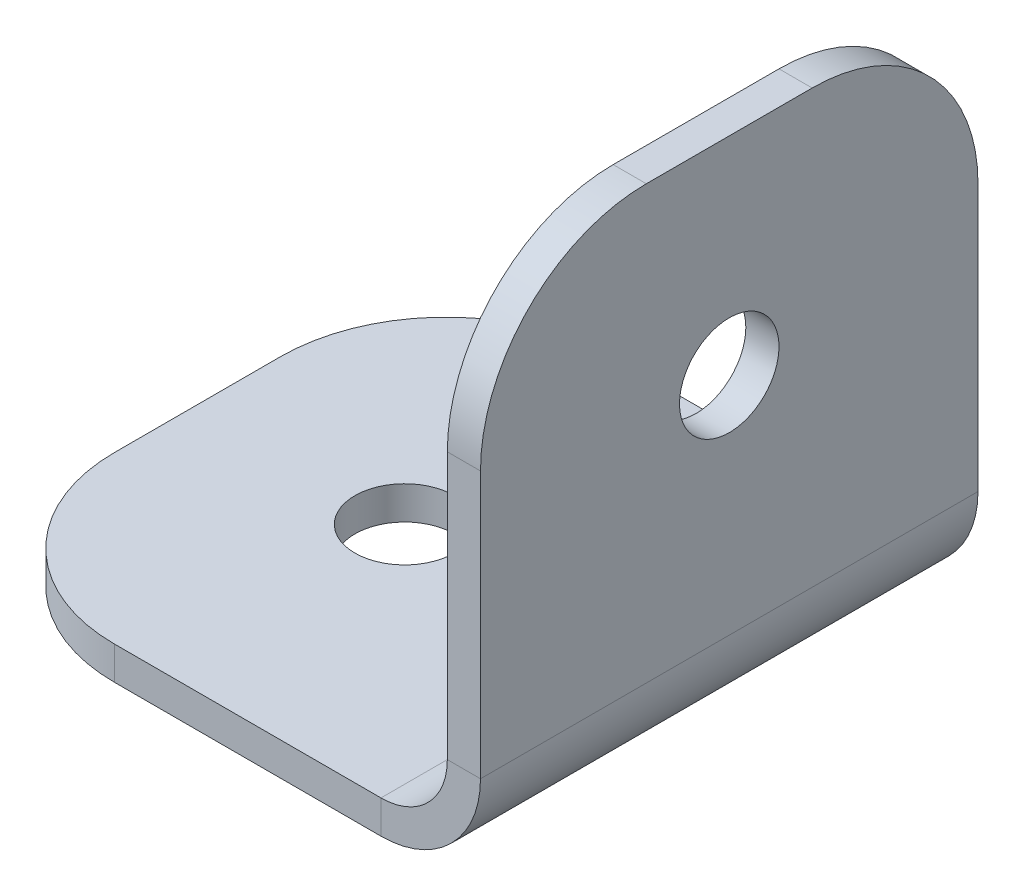
from build123d import *

# Parameters (mm, degrees)
SKETCH1_R                  = 3
EXTRUDE2_DEPTH             = 2
SKETCHED_START             = 1.456569183
SKETCHED_BEND1_OUTLINE_W   = 2
SKETCHED_BEND1_OUTLINE_H   = 30
SKETCHED_BEND1_DEPTH       = 28.543430817
SKETCHED_START_2           = 0.073009183
SKETCHED_BEND1_2_OUTLINE_R = 3
SKETCHED_BEND1_2_DEPTH     = 0.036590817
SKETCHED_START_3           = 0.608704599
SKETCHED_BEND1_3_OUTLINE_W = 2
SKETCHED_BEND1_3_OUTLINE_H = 30
SKETCHED_BEND1_3_DEPTH     = 0.847864584
SKETCHED_START_4           = -3.926990817
SKETCHED_BEND1_4_OUTLINE_R = 3
SKETCHED_BEND1_4_DEPTH     = 6
SKETCHED_START_5           = -15
SKETCHED_BEND1_5_DEPTH     = 30


with BuildPart() as part:
    # Sketch1 → Extrude2 (new body)
    with BuildSketch(Plane(origin=(0, 0, 0), x_dir=(1, 0, 0), z_dir=(0, 1, 0))):
        with BuildLine():
            Line((-20, -15), (20, -15))
            ThreePointArc((20, -15), (27.071067812, -12.071067812), (30, -5))
            Line((30, -5), (30, 5))
            ThreePointArc((30, 5), (27.071067812, 12.071067812), (20, 15))
            Line((20, 15), (-20, 15))
            ThreePointArc((-20, 15), (-27.071067812, 12.071067812), (-30, 5))
            Line((-30, 5), (-30, -5))
            ThreePointArc((-30, -5), (-27.071067812, -12.071067812), (-20, -15))
        make_face()
        with Locations(Location((-17.5, 0, 0), (0, 0, 270))):
            Circle(SKETCH1_R, mode=Mode.SUBTRACT)
        with Locations(Location((17.5, 0, 0), (0, 0, 90))):
            Circle(SKETCH1_R, mode=Mode.SUBTRACT)
    extrude(amount=EXTRUDE2_DEPTH)

    # Sketched Bend1: read off the stored shape, not the designer's step
    # Sketched Bend1 outline → Sketched Bend1 (cut)
    with BuildSketch(Plane.YZ.offset(SKETCHED_START)):
        with Locations((1, 0)):
            Rectangle(SKETCHED_BEND1_OUTLINE_W, SKETCHED_BEND1_OUTLINE_H)
    extrude(amount=SKETCHED_BEND1_DEPTH, mode=Mode.SUBTRACT)

    # Sketched Bend1 2 outline → Sketched Bend1 2 (add)
    with BuildSketch(Plane.YZ.offset(SKETCHED_START_2)):
        with BuildLine():
            Line((22.073009183, 15), (2, 15))
            Line((2, 15), (2, -15))
            Line((2, -15), (22.073009183, -15))
            ThreePointArc((22.073009183, -15), (29.144076995, -12.071067812), (32.073009183, -5))
            Line((32.073009183, -5), (32.073009183, 5))
            ThreePointArc((32.073009183, 5), (29.144076995, 12.071067812), (22.073009183, 15))
        make_face()
        with Locations((19.573009183, 0)):
            Circle(SKETCHED_BEND1_2_OUTLINE_R, mode=Mode.SUBTRACT)
    extrude(amount=SKETCHED_BEND1_2_DEPTH)

    # Sketched Bend1 3 outline → Sketched Bend1 3 (cut)
    with BuildSketch(Plane.YZ.offset(SKETCHED_START_3)):
        with Locations((1, 0)):
            Rectangle(SKETCHED_BEND1_3_OUTLINE_W, SKETCHED_BEND1_3_OUTLINE_H)
    extrude(amount=SKETCHED_BEND1_3_DEPTH, mode=Mode.SUBTRACT)

    # Sketched Bend1 4 outline → Sketched Bend1 4 (add)
    with BuildSketch(Plane.YZ.offset(SKETCHED_START_4)):
        with BuildLine():
            Line((22.073009183, 15), (2, 15))
            Line((2, 15), (2, -15))
            Line((2, -15), (22.073009183, -15))
            ThreePointArc((22.073009183, -15), (29.144076995, -12.071067812), (32.073009183, -5))
            Line((32.073009183, -5), (32.073009183, 5))
            ThreePointArc((32.073009183, 5), (29.144076995, 12.071067812), (22.073009183, 15))
        make_face()
        with Locations((19.573009183, 0)):
            Circle(SKETCHED_BEND1_4_OUTLINE_R, mode=Mode.SUBTRACT)
    extrude(amount=SKETCHED_BEND1_4_DEPTH)

    # Sketched Bend1 5 outline → Sketched Bend1 5 (cut)
    with BuildSketch(Plane.XY.offset(SKETCHED_START_5)):
        with BuildLine():
            ThreePointArc((-3.926990817, 2), (-1.098563692, 3.171572875), (0.073009183, 6))
            Line((0.073009183, 6), (0.073009183, 32.073009183))
            Line((0.073009183, 32.073009183), (-3.926990817, 32.073009183))
            Line((-3.926990817, 32.073009183), (-3.926990817, 2))
        make_face()
        with BuildLine():
            Line((2.073009183, 2), (2.073009183, 6))
            ThreePointArc((2.073009183, 6), (0.31564987, 1.757359313), (-3.926990817, 0))
            Line((-3.926990817, 0), (0.608704599, 0))
            Line((0.608704599, 0), (0.608704599, 2))
            Line((0.608704599, 2), (2.073009183, 2))
        make_face()
    extrude(amount=SKETCHED_BEND1_5_DEPTH, mode=Mode.SUBTRACT)


solid = part.part
